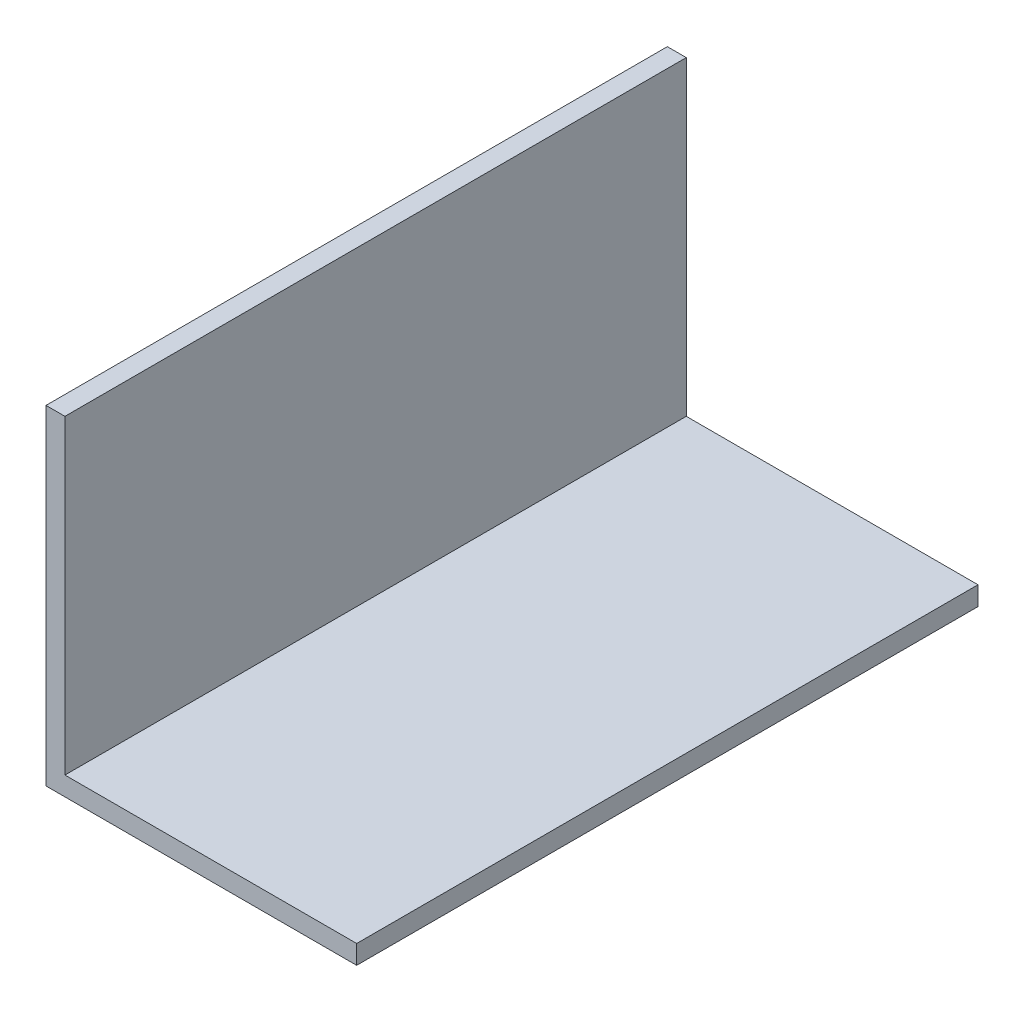
from build123d import *

# Parameters (mm, degrees)
BOSS_EXTRUDE1_DEPTH      = 4999.99999998
BOSS_EXTRUDE1_DEPTH_BACK = 4999.99


with BuildPart() as part:
    # wall → Boss-Extrude1 (new, two sides: drawn at the far end of the back side and taken through both)
    with BuildSketch(Plane.XY.offset(-BOSS_EXTRUDE1_DEPTH_BACK)):
        Polygon((0, 0), (0, 5304.79999998), (304.8, 5304.79999998), (304.8, 304.8), (4999.99999998, 304.8), (4999.99999998, 0), align=None)
    extrude(amount=BOSS_EXTRUDE1_DEPTH + BOSS_EXTRUDE1_DEPTH_BACK)


solid = part.part
